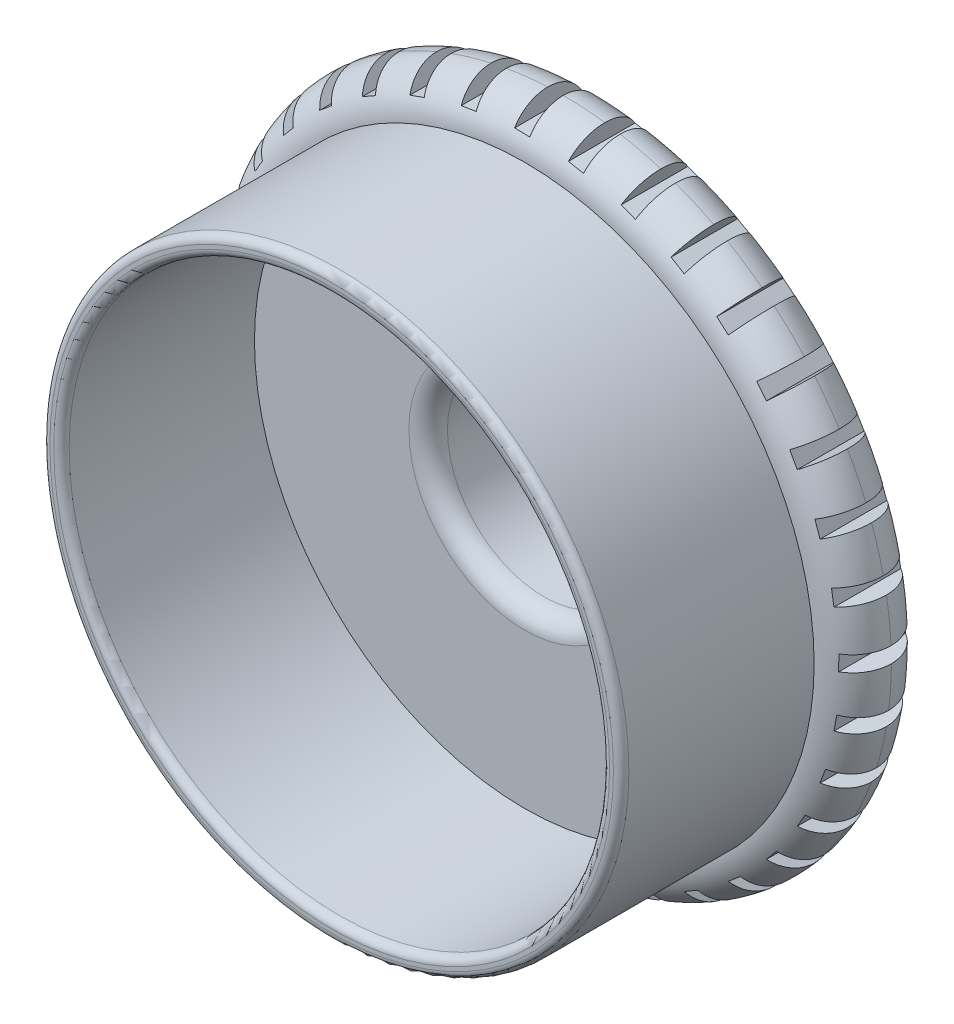
from build123d import *

# Parameters (mm, degrees)
SKICA1_R                 = 7.5
SKICA1_R_2               = 7
P_IDAT_VYSUNUT_M1_DEPTH  = 5
SKICA2_R                 = 8.5
P_IDAT_VYSUNUT_M2_DEPTH  = 2
ZAOBLIT1_R               = 1
SKICA4_R                 = 2.5
ODEBRAT_VYSUNUT_M1_DEPTH = 15.103633683
ZAOBLIT2_R               = 0.2
ZAOBLIT3_R               = 0.5
ZAOBLIT4_R               = 0.5
SKICA5_W                 = 2
SKICA5_H                 = 0.4
ODEBRAT_VYSUNUT_M2_DEPTH = 0.5
KRUHOV_POLE1_COUNT       = 36


with BuildPart() as part:
    # Skica1 → Přidat vysunutím1 (new body)
    with BuildSketch(Plane.XY):
        Circle(SKICA1_R)
        Circle(SKICA1_R_2, mode=Mode.SUBTRACT)
    extrude(amount=-P_IDAT_VYSUNUT_M1_DEPTH)

    # Skica2 → Přidat vysunutím2 (add)
    with BuildSketch(Plane(origin=(0, 0, -5), x_dir=(-1, 0, 0), z_dir=(0, 0, -1))):
        Circle(SKICA2_R)
    extrude(amount=P_IDAT_VYSUNUT_M2_DEPTH)

    # Zaoblit1
    zaoblit1_edges = [part.edges().sort_by_distance(p)[0] for p in [
        (8.5, 0, -7),
        (8.5, 0, -5),
    ]]
    fillet(zaoblit1_edges, radius=ZAOBLIT1_R - 0.0001)  # a hair under: the kernel refuses the full size

    # Skica3 → Rotovat1 (revolve)
    with BuildSketch(Plane(origin=(0, 0, 0), x_dir=(1, 0, 0), z_dir=(0, 1, 0))):
        Polygon((-7.5, 7), (-5.5, 7.376481638), (0, 7.376481638), (0, 7), align=None)
    revolve(axis=Axis((0, 0, -7.376481638), (0, 0, 1)))

    # Skica4 → Odebrat vysunutím1 (cut, through all)
    with BuildSketch(Plane(origin=(0, 0, -7.376481638), x_dir=(-1, 0, 0), z_dir=(0, 0, -1))):
        Circle(SKICA4_R)
    extrude(amount=-ODEBRAT_VYSUNUT_M1_DEPTH, mode=Mode.SUBTRACT)

    # Zaoblit2
    zaoblit2_edges = [part.edges().sort_by_distance(p)[0] for p in [
        (-7.5, 0, 0),
        (-7, 0, 0),
    ]]
    fillet(zaoblit2_edges, radius=ZAOBLIT2_R)

    # Zaoblit3
    zaoblit3_edges = [part.edges().sort_by_distance(p)[0] for p in [
        (2.5, 0, -7.376481638),
    ]]
    fillet(zaoblit3_edges, radius=ZAOBLIT3_R)

    # Zaoblit4
    zaoblit4_edges = [part.edges().sort_by_distance(p)[0] for p in [
        (2.5, 0, -5),
    ]]
    fillet(zaoblit4_edges, radius=ZAOBLIT4_R)

    # Skica5 → Odebrat vysunutím2 (cut)
    with BuildSketch(Plane(origin=(8.5, 0, 0), x_dir=(0, 0, -1), z_dir=(1, 0, 0))):
        with Locations((6, 0.2)):
            Rectangle(SKICA5_W, SKICA5_H)
    odebrat_vysunut_m2 = extrude(amount=-ODEBRAT_VYSUNUT_M2_DEPTH, mode=Mode.SUBTRACT)

    # Kruhové pole1: Odebrat vysunutím2 ×36 about axis
    kruhov_pole1_axis = Axis((0, 0, 0), (0, 0, 1))
    for i in range(1, KRUHOV_POLE1_COUNT):
        add(odebrat_vysunut_m2.rotate(kruhov_pole1_axis, i * 360 / KRUHOV_POLE1_COUNT), mode=Mode.SUBTRACT)


solid = part.part
